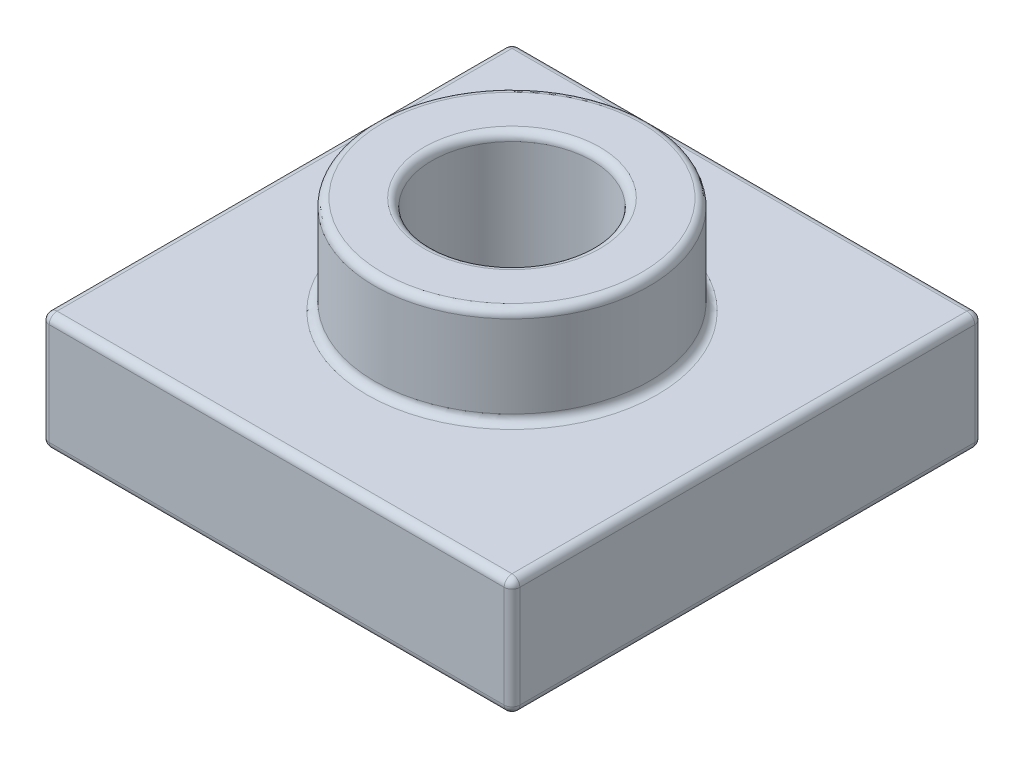
from build123d import *

# Parameters (mm, degrees)
SKETCH1_W            = 120
SKETCH1_H            = 120
BOSS_EXTRUDE1_DEPTH  = 30
SKETCH2_R            = 35
BOSS_EXTRUDE2_DEPTH  = 25
SKETCH3_R            = 20.425210732
CUT_EXTRUDE1_DEPTH   = 102.118742081
FILLET10_R           = 2
SHELL1_OUTLINE_W     = 116
SHELL1_OUTLINE_H     = 116
SHELL1_OUTLINE_R     = 22.425210732
SHELL1_DEPTH         = 28
SHELL1_START         = 28
SHELL1_2_OUTLINE_R   = 33
SHELL1_2_OUTLINE_R_2 = 22.425210732
SHELL1_2_DEPTH       = 25


with BuildPart() as part:
    # Sketch1 → Boss-Extrude1 (new body)
    with BuildSketch(Plane(origin=(0, 0, 0), x_dir=(1, 0, 0), z_dir=(0, 1, 0))):
        Rectangle(SKETCH1_W, SKETCH1_H)
    extrude(amount=BOSS_EXTRUDE1_DEPTH)

    # Sketch2 → Boss-Extrude2 (add)
    with BuildSketch(Plane(origin=(0, 30, 0), x_dir=(1, 0, 0), z_dir=(0, 1, 0))):
        with Locations(Location((0, 0, 0), (0, 0, 270))):
            Circle(SKETCH2_R)
    extrude(amount=BOSS_EXTRUDE2_DEPTH)

    # Sketch3 → Cut-Extrude1 (cut, through all)
    with BuildSketch(Plane(origin=(0, 55, 0), x_dir=(1, 0, 0), z_dir=(0, 1, 0))):
        with Locations(Location((0, 0, 0), (0, 0, 270))):
            Circle(SKETCH3_R)
    extrude(amount=-CUT_EXTRUDE1_DEPTH, mode=Mode.SUBTRACT)

    # Fillet10
    fillet10_edges = [part.edges().sort_by_distance(p)[0] for p in [
        (-60, 30, 0),
        (0, 30, -35),
        (0, 55, -35),
        (0, 30, 60),
        (0, 0, -20.425210732),
        (0, 55, -20.425210732),
        (60, 30, 0),
        (0, 0, 60),
        (-60, 0, 0),
        (0, 0, -60),
        (60, 0, 0),
        (60, 15, 60),
        (-60, 15, 60),
        (-60, 15, -60),
        (60, 15, -60),
        (0, 30, -60),
    ]]
    fillet(fillet10_edges, radius=FILLET10_R)

    # Shell1: read off the stored shape, not the designer's step
    # Shell1 outline → Shell1 (cut)
    with BuildSketch(Plane(origin=(0, 0, 0), x_dir=(1, 0, 0), z_dir=(0, 1, 0))):
        Rectangle(SHELL1_OUTLINE_W, SHELL1_OUTLINE_H)
        Circle(SHELL1_OUTLINE_R, mode=Mode.SUBTRACT)
    extrude(amount=SHELL1_DEPTH, mode=Mode.SUBTRACT)

    # Shell1 2 outline → Shell1 2 (cut)
    with BuildSketch(Plane(origin=(0, 0, 0), x_dir=(1, 0, 0), z_dir=(0, 1, 0)).offset(SHELL1_START)):
        Circle(SHELL1_2_OUTLINE_R)
        Circle(SHELL1_2_OUTLINE_R_2, mode=Mode.SUBTRACT)
    extrude(amount=SHELL1_2_DEPTH, mode=Mode.SUBTRACT)

    # Shell1 3 outline → Shell1 3 (revolve, cut)
    with BuildSketch(Plane.XY):
        with BuildLine():
            ThreePointArc((37, 28), (34.171572875, 29.171572875), (33, 32))
            Line((33, 32), (33, 28))
            Line((33, 28), (37, 28))
        make_face()
    revolve(axis=Axis((0, 0, 0), (0, 1, 0)), mode=Mode.SUBTRACT)


solid = part.part
